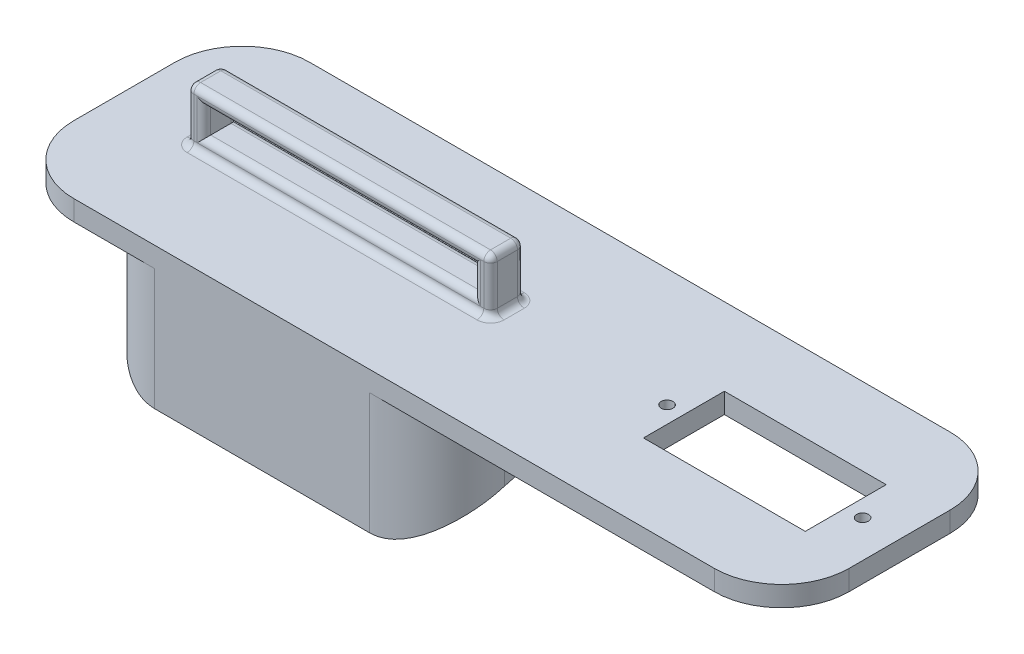
from build123d import *

# Parameters (mm, degrees)
SKETCH1_W           = 115
SKETCH1_H           = 35
BOSS_EXTRUDE1_DEPTH = 3
FILLET1_R           = 10
SKETCH2_W           = 45
SKETCH2_H           = 5
BOSS_EXTRUDE2_DEPTH = 8
SKETCH3_W           = 40
SKETCH3_H           = 4
CUT_EXTRUDE1_DEPTH  = 62.763488753
FILLET2_R           = 1
SKETCH4_W           = 24
SKETCH4_H           = 12
CUT_EXTRUDE2_DEPTH  = 61.634148794
BOSS_EXTRUDE3_DEPTH = 18
FILLET3_R           = 10
FILLET4_R           = 10
SKETCH12_R          = 0.875
CUT_EXTRUDE3_DEPTH  = 64.675135077
CUT_EXTRUDE4_DEPTH  = 58


# Some blends are built 0.0001 mm under size
with BuildPart() as part:
    # Sketch1 → Boss-Extrude1 (new body)
    with BuildSketch(Plane(origin=(0, 0, 0), x_dir=(1, 0, 0), z_dir=(0, 1, 0))):
        Rectangle(SKETCH1_W, SKETCH1_H)
    extrude(amount=BOSS_EXTRUDE1_DEPTH)

    # Fillet1
    fillet1_edges = [part.edges().sort_by_distance(p)[0] for p in [
        (-57.5, 1.5, -17.5),
        (57.5, 1.5, -17.5),
        (57.5, 1.5, 17.5),
        (-57.5, 1.5, 17.5),
    ]]
    fillet(fillet1_edges, radius=FILLET1_R)

    # Sketch2 → Boss-Extrude2 (add)
    with BuildSketch(Plane(origin=(0, 3, 0), x_dir=(1, 0, 0), z_dir=(0, 1, 0))):
        with Locations((-23.5, 0.315525333)):
            Rectangle(SKETCH2_W, SKETCH2_H)
    extrude(amount=BOSS_EXTRUDE2_DEPTH)

    # Sketch3 → Cut-Extrude1 (cut, through all)
    with BuildSketch(Plane.XY.offset(2.184474667)):
        with Locations((-23.5, 7)):
            Rectangle(SKETCH3_W, SKETCH3_H)
    extrude(amount=-CUT_EXTRUDE1_DEPTH, mode=Mode.SUBTRACT)

    # Fillet2
    fillet2_edges = [part.edges().sort_by_distance(p)[0] for p in [
        (-1, 3, -0.315525333),
        (-1, 7, 2.184474667),
        (-23.5, 3, -2.815525333),
        (-1, 7, -2.815525333),
        (-46, 3, -0.315525333),
        (-46, 7, -2.815525333),
        (-23.5, 3, 2.184474667),
        (-46, 7, 2.184474667),
        (-1, 11, -0.315525333),
        (-23.5, 11, -2.815525333),
        (-46, 11, -0.315525333),
        (-23.5, 11, 2.184474667),
        (-43.5, 7, -2.815525333),
        (-23.5, 9, -2.815525333),
        (-23.5, 5, -2.815525333),
        (-43.5, 7, 2.184474667),
        (-23.5, 5, 2.184474667),
        (-3.5, 7, 2.184474667),
        (-23.5, 9, 2.184474667),
    ]]
    fillet(fillet2_edges, radius=FILLET2_R - 0.0001)  # a hair under: the kernel refuses the full size

    # Sketch4 → Cut-Extrude2 (cut, through all)
    with BuildSketch(Plane(origin=(0, 3, 0), x_dir=(1, 0, 0), z_dir=(0, 1, 0))):
        with Locations((37.5, 0)):
            Rectangle(SKETCH4_W, SKETCH4_H)
    extrude(amount=-CUT_EXTRUDE2_DEPTH, mode=Mode.SUBTRACT)

    # Sketch11 → Boss-Extrude3 (add)
    with BuildSketch(Plane(origin=(0, 0, 0), x_dir=(-1, 0, 0), z_dir=(0, -1, 0))):
        Polygon((-6.369569975, 0), (-6.369569975, -17.5), (45.499835489, -17.5), (45.499835489, 17.536176175), (-6.369569975, 17.5), align=None)
    extrude(amount=BOSS_EXTRUDE3_DEPTH)

    # Fillet3
    # the kernel refuses this fillet: 10 mm, written as the material it takes off along each edge
    with BuildSketch(Plane(origin=(-45.499835489, 0, 17.5), x_dir=(1, 0, 0), z_dir=(0, -1, 0))) as fillet3_piece_1:
        with BuildLine():
            CenterArc((FILLET3_R, -FILLET3_R), FILLET3_R, 90, 90)
            Line((0, -FILLET3_R), (0, 0))
            Line((0, 0), (FILLET3_R, 0))
        make_face()
    extrude(amount=43, mode=Mode.SUBTRACT)
    with BuildSketch(Plane(origin=(-45.499835489, 0, -17.536176175), x_dir=(0, 0, 1), z_dir=(0, -1, 0))) as fillet3_piece_2:
        with BuildLine():
            CenterArc((FILLET3_R * 1.00069769048, -FILLET3_R), FILLET3_R, 90, 90.039960778)
            Line((FILLET3_R * 0.000697933699006, -FILLET3_R * 1.0006974471), (0, 0))
            Line((0, 0), (FILLET3_R * 1.00069769048, 0))
        make_face()
    extrude(amount=43.017442262, mode=Mode.SUBTRACT)

    # Fillet4
    # the kernel refuses this fillet: 10 mm, written as the material it takes off along each edge
    with BuildSketch(Plane(origin=(6.369569975, 0, -17.5), x_dir=(0, 0, 1), z_dir=(0, -1, 0))) as fillet4_piece_1:
        with BuildLine():
            CenterArc((FILLET4_R * 0.99930279595, FILLET4_R), FILLET4_R, 180.039960778, 89.960039222)
            Line((-FILLET4_R * 0.000696960833864, FILLET4_R * 0.999302552903), (0, 0))
            Line((0, 0), (FILLET4_R * 0.99930279595, 0))
        make_face()
    extrude(amount=42.982569899, mode=Mode.SUBTRACT)
    with BuildSketch(Plane(origin=(6.369569975, 0, 17.5), x_dir=(0, 0, -1), z_dir=(0, -1, 0))) as fillet4_piece_2:
        with BuildLine():
            CenterArc((FILLET4_R, -FILLET4_R), FILLET4_R, 90, 90)
            Line((0, -FILLET4_R), (0, 0))
            Line((0, 0), (FILLET4_R, 0))
        make_face()
    extrude(amount=43, mode=Mode.SUBTRACT)

    # Sketch12 → Cut-Extrude3 (cut, through all)
    with BuildSketch(Plane(origin=(0, 3, 0), x_dir=(1, 0, 0), z_dir=(0, 1, 0))):
        with Locations(Location((23, 0, 0), (0, 0, 270))):
            Circle(SKETCH12_R)
        with Locations(Location((52, 0, 0), (0, 0, 270))):
            Circle(SKETCH12_R)
    extrude(amount=-CUT_EXTRUDE3_DEPTH, mode=Mode.SUBTRACT)

    # Sketch13 → Cut-Extrude4 (cut)
    with BuildSketch(Plane.ZY.offset(45.499835489)):
        with BuildLine():
            Line((-17.52919927, -18), (17.5, -18))
            ThreePointArc((17.5, -18), (-0.014599635, -10.875312322), (-17.52919927, -18))
        make_face()
    extrude(amount=-CUT_EXTRUDE4_DEPTH, mode=Mode.SUBTRACT)


solid = part.part
